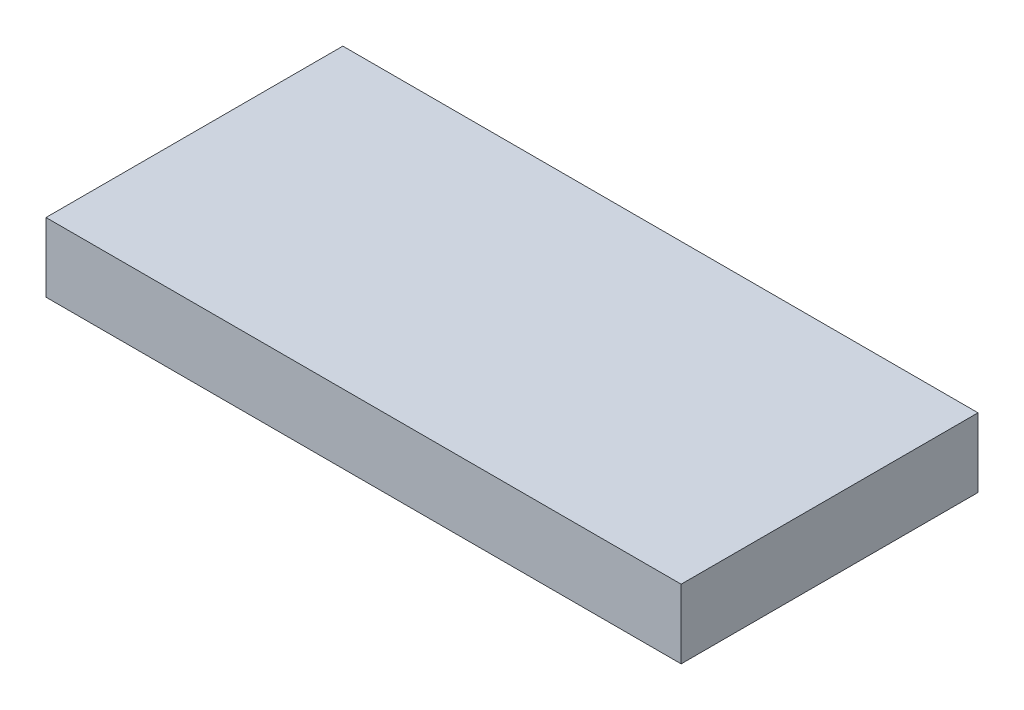
from build123d import *

# Parameters (mm, degrees)
SKETCH1_W   = 184
SKETCH1_H   = 86
PLATE_DEPTH = 20


with BuildPart() as part:
    # Sketch1 → plate (new body)
    with BuildSketch(Plane(origin=(0, 0, 0), x_dir=(1, 0, 0), z_dir=(0, 1, 0))):
        Rectangle(SKETCH1_W, SKETCH1_H)
    extrude(amount=PLATE_DEPTH)


solid = part.part
